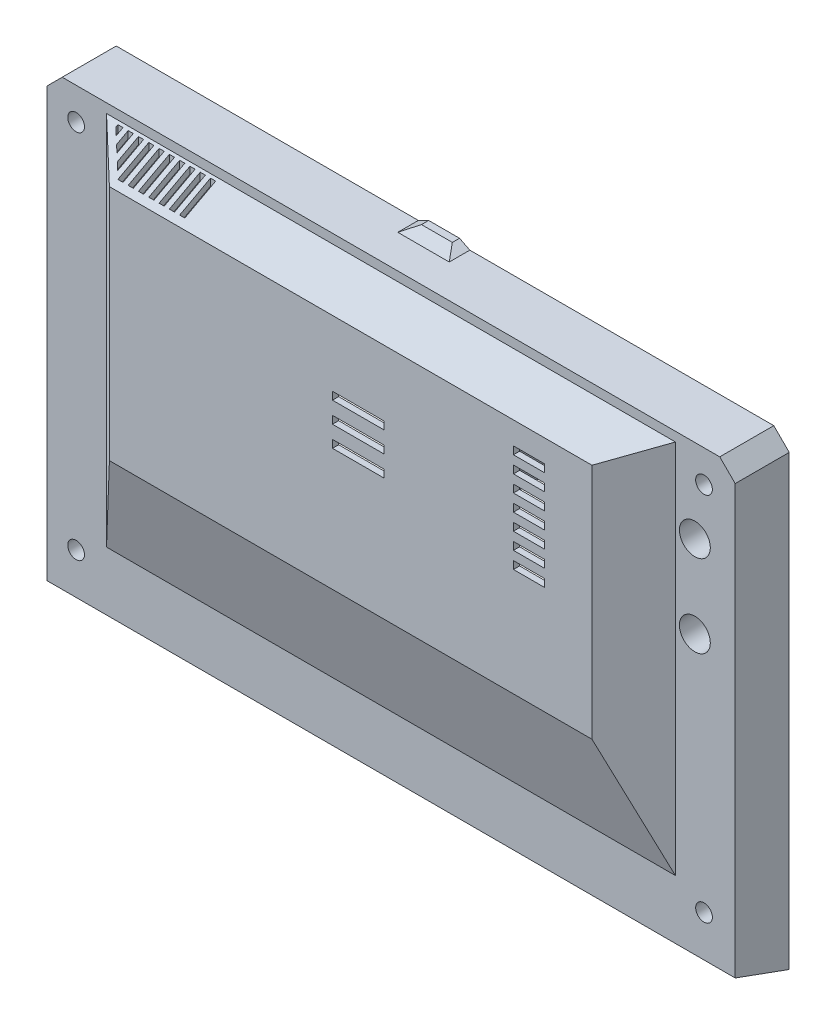
from build123d import *

# Parameters (mm, degrees)
SKETCH1_R              = 1.62500056
BOSS_EXTRUDE1_DEPTH    = 8
CUT_EXTRUDE1_DEPTH     = 143.382327669
SKETCH3_W              = 93.760231923
SKETCH3_H              = 46.103458809
BOSS_EXTRUDE2_DEPTH    = 1.5
SKETCH4_R              = 1.62500056
BOSS_EXTRUDE3_DEPTH    = 1
CUT_EXTRUDE3_DEPTH     = 144.227065665
SKETCH7_R              = 1.62500056
SKETCH7_W              = 109.760231923
SKETCH7_H              = 74.103458809
BOSS_EXTRUDE4_DEPTH    = 1.5
CUT_EXTRUDE2_DEPTH     = 144.227065665
SKETCH11_W             = 109.760231923
SKETCH11_H             = 3
BOSS_EXTRUDE5_DEPTH    = 1.5
SHELL1_T               = -1.2
SKETCH12_W             = 1.5
SKETCH12_H             = 15.600000983
SKETCH12_H_2           = 10
BOSS_EXTRUDE6_DEPTH    = 5.5
SKETCH13_W             = 1.5
SKETCH13_H             = 40
BOSS_EXTRUDE7_DEPTH    = 14.6
BOSS_EXTRUDE8_DEPTH    = 1.49999999
CUT_EXTRUDE4_START     = -6.6499306
CUT_EXTRUDE4_OUTLINE_W = 1
CUT_EXTRUDE4_OUTLINE_H = 6
CUT_EXTRUDE4_DEPTH     = 4.577832487
SKETCH16_W             = 6.000000948
SKETCH16_H             = 1.5
SKETCH16_H_2           = 0.783333333
SKETCH16_H_3           = 0.716666667
SKETCH16_W_2           = 10
CUT_EXTRUDE5_DEPTH     = 13.5
SKETCH17_R             = 3
CUT_EXTRUDE6_DEPTH     = 84.027826949
SKETCH18_R             = 3
BOSS_EXTRUDE9_DEPTH    = 9


# Read off the part's stored shape, not the designer's step: Cut-Extrude4
with BuildPart() as part:
    # Sketch1 → Boss-Extrude1 (new body)
    with BuildSketch(Plane.XY):
        Polygon((-66.7, -48.134474014), (67.060231922, -48.134474014), (67.060231922, 39.2), (64.060231922, 42.2), (5, 42.2), (3, 43.2), (-3, 43.2), (-5, 42.2), (-63.7, 42.2), (-66.7, 39.2), align=None)
        with BuildLine():
            Line((-56.99999784, -43.134474014), (-56.99999784, -35.99999786))
            ThreePointArc((-56.99999784, -35.99999786), (-58.171570715, -33.171570735), (-60.99999784, -31.99999786))
            Line((-60.99999784, -31.99999786), (-65.2, -31.99999786))
            Line((-65.2, -31.99999786), (-65.2, 32.00000038))
            Line((-65.2, 32.00000038), (-65.2, 36.00000038))
            Line((-65.2, 36.00000038), (-64.1249984, 36.00000038))
            ThreePointArc((-64.1249984, 36.00000038), (-58.790288753, 33.790291293), (-60.99999784, 39.12500094))
            Line((-60.99999784, 39.12500094), (-60.99999784, 40.2))
            Line((-60.99999784, 40.2), (-56.99999784, 40.2))
            Line((-56.99999784, 40.2), (-56.99999784, 41.2))
            Line((-56.99999784, 41.2), (-34.380966811, 41.2))
            Line((-34.380966811, 41.2), (-34.380966811, 40.2))
            Line((-34.380966811, 40.2), (-10, 40.2))
            Line((-10, 40.2), (-10, 41.2))
            Line((-10, 41.2), (10, 41.2))
            Line((10, 41.2), (10, 40.2))
            Line((10, 40.2), (57.000002, 40.2))
            Line((57.000002, 40.2), (57.87500144, 40.2))
            Line((57.87500144, 40.2), (57.87500144, 36.00000038))
            ThreePointArc((57.87500144, 36.00000038), (58.790292913, 33.790291293), (61.000002, 32.87499982))
            Line((61.000002, 32.87499982), (65.20000162, 32.87499982))
            Line((65.20000162, 32.87499982), (65.20000162, -31.99999786))
            Line((65.20000162, -31.99999786), (61.000002, -31.99999786))
            ThreePointArc((61.000002, -31.99999786), (58.171574875, -33.171570735), (57.000002, -35.99999786))
            Line((57.000002, -35.99999786), (57.000002, -43.134474014))
            Line((57.000002, -43.134474014), (-56.99999784, -43.134474014))
        make_face(mode=Mode.SUBTRACT)
        with Locations((61.000002, -35.99999786)):
            Circle(SKETCH1_R, mode=Mode.SUBTRACT)
        with Locations((-60.99999784, -35.99999786)):
            Circle(SKETCH1_R, mode=Mode.SUBTRACT)
        with Locations((-60.99999784, 36.00000038)):
            Circle(SKETCH1_R, mode=Mode.SUBTRACT)
        with Locations((61.000002, 36.00000038)):
            Circle(SKETCH1_R, mode=Mode.SUBTRACT)
    extrude(amount=BOSS_EXTRUDE1_DEPTH)

    # Sketch2 → Cut-Extrude1 (cut, through all)
    with BuildSketch(Plane.ZY.offset(66.7)):
        Polygon((0.489360219, -47.637108129), (26.189203179, -38.283130266), (27.850109995, -42.846434237), (-0.168950275, -53.044538167), (-1.829857091, -48.481234197), align=None)
    extrude(amount=-CUT_EXTRUDE1_DEPTH, mode=Mode.SUBTRACT)

    # Sketch4 → Boss-Extrude3 (add)
    with BuildSketch(Plane.XY.offset(8)):
        Polygon((-66.7, 39.2), (-66.7, -44.903458809), (67.060231922, -44.903458809), (67.060231922, 39.2), (64.060231922, 42.2), (5, 42.2), (3, 43.2), (-3, 43.2), (-5, 42.2), (-63.7, 42.2), align=None)
        with BuildLine():
            Line((-56.99999784, 40.2), (-34.380966811, 40.2))
            Line((-34.380966811, 40.2), (57.87500144, 40.2))
            Line((57.87500144, 40.2), (57.87500144, 36.00000038))
            ThreePointArc((57.87500144, 36.00000038), (58.790292913, 33.790291293), (61.000002, 32.87499982))
            Line((61.000002, 32.87499982), (65.20000162, 32.87499982))
            Line((65.20000162, 32.87499982), (65.20000162, -31.99999786))
            Line((65.20000162, -31.99999786), (61.000002, -31.99999786))
            ThreePointArc((61.000002, -31.99999786), (58.171574875, -33.171570735), (57.000002, -35.99999786))
            Line((57.000002, -35.99999786), (57.000002, -43.134474014))
            Line((57.000002, -43.134474014), (-56.99999784, -43.134474014))
            Line((-56.99999784, -43.134474014), (-56.99999784, -35.99999786))
            ThreePointArc((-56.99999784, -35.99999786), (-58.171570715, -33.171570735), (-60.99999784, -31.99999786))
            Line((-60.99999784, -31.99999786), (-65.2, -31.99999786))
            Line((-65.2, -31.99999786), (-65.2, 36.00000038))
            Line((-65.2, 36.00000038), (-64.1249984, 36.00000038))
            ThreePointArc((-64.1249984, 36.00000038), (-58.790288753, 33.790291293), (-60.99999784, 39.12500094))
            Line((-60.99999784, 39.12500094), (-60.99999784, 40.2))
            Line((-60.99999784, 40.2), (-56.99999784, 40.2))
        make_face(mode=Mode.SUBTRACT)
        with Locations((-60.99999784, -35.99999786)):
            Circle(SKETCH4_R, mode=Mode.SUBTRACT)
        with Locations((61.000002, -35.99999786)):
            Circle(SKETCH4_R, mode=Mode.SUBTRACT)
        with Locations((-60.99999784, 36.00000038)):
            Circle(SKETCH4_R, mode=Mode.SUBTRACT)
        with Locations((61.000002, 36.00000038)):
            Circle(SKETCH4_R, mode=Mode.SUBTRACT)
    extrude(amount=BOSS_EXTRUDE3_DEPTH)

    # Sketch6 → Cut-Extrude3 (cut, through all)
    with BuildSketch(Plane.ZY.offset(66.7)):
        Polygon((9, 42.2), (4, 42.2), (-5.266422624, 45.757046379), (9, 45.757046379), align=None)
    extrude(amount=-CUT_EXTRUDE3_DEPTH, mode=Mode.SUBTRACT)

    # Sketch7 → Boss-Extrude4 (add)
    with BuildSketch(Plane.XY.offset(9)):
        Polygon((64.060231922, 42.2), (-63.7, 42.2), (-66.7, 39.2), (-66.7, -44.903458809), (67.060231922, -44.903458809), (67.060231922, 39.2), align=None)
        with Locations((-60.99999784, 36.00000038)):
            Circle(SKETCH7_R, mode=Mode.SUBTRACT)
        with Locations((-60.99999784, -35.99999786)):
            Circle(SKETCH7_R, mode=Mode.SUBTRACT)
        with Locations((61.000002, 36.00000038)):
            Circle(SKETCH7_R, mode=Mode.SUBTRACT)
        with Locations((61.000002, -35.99999786)):
            Circle(SKETCH7_R, mode=Mode.SUBTRACT)
        with Locations((0.180116412, 2.148270596)):
            Rectangle(SKETCH7_W, SKETCH7_H, mode=Mode.SUBTRACT)
    extrude(amount=BOSS_EXTRUDE4_DEPTH)

    # Sketch5 → Cut-Extrude2 (cut, through all)
    with BuildSketch(Plane.ZY.offset(66.7)):
        Polygon((0, -47.815220683), (19.162541705, -40.840625889), (17.330059172, -50.376915135), align=None)
    extrude(amount=-CUT_EXTRUDE2_DEPTH, mode=Mode.SUBTRACT)

    # Sketch11 → Boss-Extrude5 (add)
    with BuildSketch(Plane.XY.offset(10.5)):
        with Locations((0.180116412, -33.403458809)):
            Rectangle(SKETCH11_W, SKETCH11_H)
    extrude(amount=-BOSS_EXTRUDE5_DEPTH)


with BuildPart() as body_2:
    # Sketch3 → Boss-Extrude2 (new body)
    with BuildSketch(Plane(origin=(7.36e-07, 0, 16.827500956), x_dir=(0.999999999999999, 0, -4.371140912995992e-08), z_dir=(4.371140912995992e-08, 0, 0.9999999999999991))):
        with Locations((0.180115611, 13.148270596)):
            Rectangle(SKETCH3_W, SKETCH3_H)
    extrude(amount=BOSS_EXTRUDE2_DEPTH)

    # Sketch8 → Loft1 section 0
    with BuildSketch(Plane(origin=(8.01e-07, 0, 18.327500956), x_dir=(0.999999999999999, 0, -4.371140913900529e-08), z_dir=(4.371140913900529e-08, 0, 0.9999999999999991))):
        with BuildLine():
            Line((47.060231573, -9.903458809), (47.060231573, 36.2))
            Line((47.060231573, 36.2), (-46.70000035, 36.2))
            Line((-46.70000035, 36.2), (-46.70000035, -9.903458809))
            Line((-46.70000035, -9.903458809), (47.060231573, -9.903458809))
        make_face()
    # Sketch10 → Loft1 section 1
    with BuildSketch(Plane(origin=(0, 0, 9), x_dir=(-1, 0, 0), z_dir=(0, 0, -1))):
        with BuildLine():
            Line((-57.060232374, 41.2), (-57.060232374, -36.903458809))
            Line((-57.060232374, -36.903458809), (56.699999549, -36.903458809))
            Line((56.699999549, -36.903458809), (56.699999549, 41.2))
            Line((56.699999549, 41.2), (-57.060232374, 41.2))
        make_face()
    loft()

    # Shell1
    shell1_openings = [body_2.faces().sort_by_distance(p)[0] for p in [
        (0.180116413, 2.148270596, 9),
    ]]
    offset(amount=SHELL1_T, openings=shell1_openings, kind=Kind.INTERSECTION)


with BuildPart() as part_1:
    add(part.part)

    # Combine1: union body 2
    add(body_2.part)

    # Sketch12 → Boss-Extrude6 (add)
    with BuildSketch(Plane(origin=(7.49e-07, 0, 17.127500956), x_dir=(-0.999999999999999, 0, 4.371140913900529e-08), z_dir=(-4.371140913900529e-08, 0, -0.9999999999999991))):
        with Locations((-11.38903342, 18.639964748)):
            Rectangle(SKETCH12_W, SKETCH12_H)
        with Locations((-30.049033277, 27.829966208)):
            Rectangle(SKETCH12_W, SKETCH12_H_2)
    extrude(amount=BOSS_EXTRUDE6_DEPTH)

    # Sketch13 → Boss-Extrude7 (add)
    with BuildSketch(Plane(origin=(8.01e-07, 0, 18.327500956), x_dir=(0.999999999999999, 0, -4.371140913900529e-08), z_dir=(4.371140913900529e-08, 0, 0.9999999999999991))):
        with Locations((-32.630966909, 14.969963031)):
            Rectangle(SKETCH13_W, SKETCH13_H)
    extrude(amount=-BOSS_EXTRUDE7_DEPTH)

    # Sketch14 → Boss-Extrude8 (add)
    with BuildSketch(Plane(origin=(-31.880966909, 0, 1.394e-06), x_dir=(-4.371140913900528e-08, 0, -0.999999999999999), z_dir=(0.9999999999999991, 0, -4.371140913900528e-08))):
        Polygon((-3.727500956, -5.030036969), (-17.127500956, -5.030036969), (-17.127500956, -9.702018546), (-9.457724644, -31.903458809), (-9.224512744, -31.903458809), (-8.999997609, -31.903458809), align=None)
        Polygon((-17.127500956, 34.969963031), (-3.727500956, 34.969963031), (-8.999997609, 39.2), (-9.224512744, 39.2), (-10.191052054, 39.2), (-17.127500956, 35.481721781), align=None)
    extrude(amount=-BOSS_EXTRUDE8_DEPTH)

    # Cut-Extrude4 outline → Cut-Extrude4 (cut)
    with BuildSketch(Plane(origin=(0, 42.2, 0), x_dir=(1, 0, 0), z_dir=(0, 1, 0)).offset(CUT_EXTRUDE4_START)):
        Polygon((-51.380966312, -10.999999915), (-52.380966312, -10.999999915), (-52.380966312, -11.387594148), (-51.380966284, -12.320344407), align=None)
        Polygon((-46.380966312, -10.999999915), (-46.380966312, -16.984095885), (-46.363915626, -16.999999912), (-45.380966312, -16.999999915), (-45.380966312, -10.999999915), align=None)
        Polygon((-48.380966312, -10.999999915), (-48.380966312, -15.118595306), (-47.380966304, -16.051345588), (-47.380966312, -10.999999915), align=None)
        Polygon((-50.380966312, -10.999999915), (-50.380966312, -13.253094727), (-49.380966294, -14.185844998), (-49.380966312, -10.999999915), align=None)
        with Locations((-43.880966312, -13.999999915)):
            Rectangle(CUT_EXTRUDE4_OUTLINE_W, CUT_EXTRUDE4_OUTLINE_H)
        with Locations((-41.880966312, -13.999999915)):
            Rectangle(CUT_EXTRUDE4_OUTLINE_W, CUT_EXTRUDE4_OUTLINE_H)
        with Locations((-39.880966312, -13.999999915)):
            Rectangle(CUT_EXTRUDE4_OUTLINE_W, CUT_EXTRUDE4_OUTLINE_H)
        with Locations((-37.880966312, -13.999999915)):
            Rectangle(CUT_EXTRUDE4_OUTLINE_W, CUT_EXTRUDE4_OUTLINE_H)
        with Locations((-35.880966312, -13.999999915)):
            Rectangle(CUT_EXTRUDE4_OUTLINE_W, CUT_EXTRUDE4_OUTLINE_H)
        Polygon((-33.380966166, -16.999999915), (-33.380966428, -10.999999915), (-34.380966312, -10.999999915), (-34.380966312, -16.999999915), align=None)
    extrude(amount=CUT_EXTRUDE4_DEPTH, mode=Mode.SUBTRACT)

    # Sketch16 → Cut-Extrude5 (cut)
    with BuildSketch(Plane(origin=(7.49e-07, 0, 17.127500956), x_dir=(-0.999999999999999, 0, 4.371140913900529e-08), z_dir=(-4.371140913900529e-08, 0, -0.9999999999999991))):
        with Locations((-34.799033751, 11.779966208)):
            Rectangle(SKETCH16_W, SKETCH16_H)
        with Locations((-34.799033751, 14.996632875)):
            Rectangle(SKETCH16_W, SKETCH16_H)
        with Locations((-34.799033751, 18.213299541)):
            Rectangle(SKETCH16_W, SKETCH16_H)
        with Locations((-34.799033751, 21.429966208)):
            Rectangle(SKETCH16_W, SKETCH16_H)
        with Locations((-34.799033751, 24.646632875)):
            Rectangle(SKETCH16_W, SKETCH16_H)
        with Locations((-34.799033751, 28.221632875)):
            Rectangle(SKETCH16_W, SKETCH16_H_2)
        with Locations((-34.799033751, 27.471632875)):
            Rectangle(SKETCH16_W, SKETCH16_H_3)
        with Locations((-34.799033751, 31.079966208)):
            Rectangle(SKETCH16_W, SKETCH16_H)
        with Locations((-1.63903342, 22.689965239)):
            Rectangle(SKETCH16_W_2, SKETCH16_H)
        with Locations((-1.63903342, 18.639964748)):
            Rectangle(SKETCH16_W_2, SKETCH16_H)
        with Locations((-1.63903342, 14.589964256)):
            Rectangle(SKETCH16_W_2, SKETCH16_H)
    extrude(amount=-CUT_EXTRUDE5_DEPTH, mode=Mode.SUBTRACT)

    # Sketch17 → Cut-Extrude6 (cut, through all)
    with BuildSketch(Plane.XY.offset(10.5)):
        with Locations((59.224650496, 25.974485153)):
            Circle(SKETCH17_R)
        with Locations((59.224650496, 9.974485153)):
            Circle(SKETCH17_R)
    extrude(amount=-CUT_EXTRUDE6_DEPTH, mode=Mode.SUBTRACT)

    # Sketch18 → Boss-Extrude9 (add)
    # profile 1 of 2: a face of its own
    with BuildSketch(Plane(origin=(0, 0, 9), x_dir=(-1, 0, 0), z_dir=(0, 0, -1))):
        with BuildLine():
            ThreePointArc((-55.060232374, 27.67966013), (-63.724650496, 25.974485153), (-55.060232374, 24.269310175))
            Line((-55.060232374, 24.269310175), (-55.060232374, 27.67966013))
        make_face()
        with Locations(Location((-59.224650496, 25.974485153, 0), (0, 0, 180))):
            Circle(SKETCH18_R, mode=Mode.SUBTRACT)
    # profile 2 of 2: a face of its own
    with BuildSketch(Plane(origin=(0, 0, 9), x_dir=(-1, 0, 0), z_dir=(0, 0, -1))):
        with BuildLine():
            ThreePointArc((-55.060232374, 11.67966013), (-63.724650496, 9.974485153), (-55.060232374, 8.269310175))
            Line((-55.060232374, 8.269310175), (-55.060232374, 11.67966013))
        make_face()
        with Locations(Location((-59.224650496, 9.974485153, 0), (0, 0, 180))):
            Circle(SKETCH18_R, mode=Mode.SUBTRACT)
    extrude(amount=BOSS_EXTRUDE9_DEPTH)


solid = part_1.part
